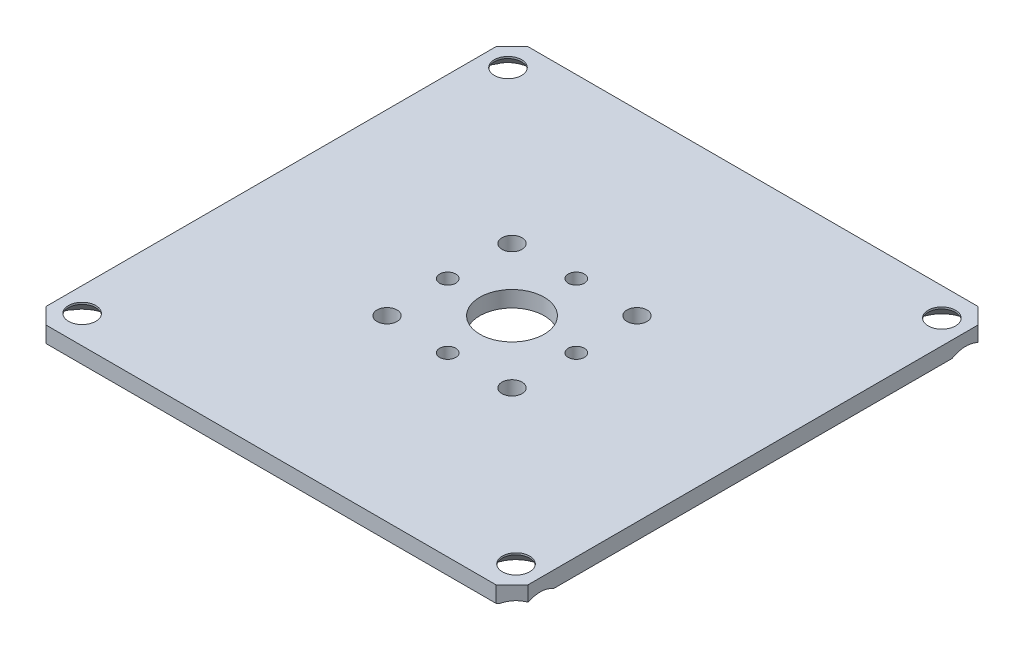
from build123d import *

# Parameters (mm, degrees)
SKETCH1_W                                    = 60
SKETCH1_H                                    = 2
BASE_FLANGE1_DEPTH                           = 60
SKETCH2_R                                    = 1.25
CUT_EXTRUDE1_DEPTH                           = 10
CSK_FOR_M3_HEX_SOCKET_COUNTERSUNK_HE_2_COUNT = 2
CSK_FOR_M3_HEX_SOCKET_COUNTERSUNK_HE_2_PITCH = 54
CSK_FOR_M3_HEX_SOCKET_COUNTERSUNK_HE_3_COUNT = 2
CSK_FOR_M3_HEX_SOCKET_COUNTERSUNK_HE_3_PITCH = 53
CSK_FOR_M3_HEX_SOCKET_COUNTERSUNK_HE_4_COUNT = 2
CSK_FOR_M3_HEX_SOCKET_COUNTERSUNK_HE_4_PITCH = 75.663729752
CUT_EXTRUDE2_REACH                           = 69.112
SKETCH4_R                                    = 4
CHAMFER1_SIZE                                = 2
CUT_EXTRUDE3_REACH                           = 69.112
SKETCH5_R                                    = 1.25
SKETCH5_R_2                                  = 1


# Sheet-metal steps are written as plain solids
with BuildPart() as part:
    # Sketch1 → Base-Flange1 (new body)
    with BuildSketch(Plane.XY):
        with Locations((0, -1)):
            Rectangle(SKETCH1_W, SKETCH1_H)
    extrude(amount=BASE_FLANGE1_DEPTH)

    # Sketch2 → Cut-Extrude1 (cut)
    with BuildSketch(Plane(origin=(0, 0, 0), x_dir=(1, 0, 0), z_dir=(0, 1, 0))):
        with Locations(Location((-27, -3.5, 0), (0, 0, 270))):
            Circle(SKETCH2_R)
        with Locations(Location((-27, -56.5, 0), (0, 0, 270))):
            Circle(SKETCH2_R)
        with Locations(Location((27, -56.5, 0), (0, 0, 270))):
            Circle(SKETCH2_R)
        with Locations(Location((27, -3.5, 0), (0, 0, 270))):
            Circle(SKETCH2_R)
    extrude(amount=-CUT_EXTRUDE1_DEPTH, mode=Mode.SUBTRACT)

    # Sketch3 → CSK for M3 Hex Socket Countersunk Head Screw1 (revolve, cut)
    with BuildSketch(Plane(origin=(27, -2, 3.5), x_dir=(0, 0, -1), z_dir=(1, 0, 0))):
        Polygon((0, 0), (0, 2), (1.7, 2), (1.7, 1.77), (3.47, 0), align=None)
    csk_for_m3_hex_socket_countersunk_head_s = revolve(axis=Axis((27, -8.35, 3.5), (0, 1, 0)), mode=Mode.SUBTRACT)

    # CSK for M3 Hex Socket Countersunk He 2: CSK for M3 Hex Socket Countersunk Head Screw1 ×2
    with Locations(*[(-i * CSK_FOR_M3_HEX_SOCKET_COUNTERSUNK_HE_2_PITCH, 0, 0) for i in range(1, CSK_FOR_M3_HEX_SOCKET_COUNTERSUNK_HE_2_COUNT)]):
        add(csk_for_m3_hex_socket_countersunk_head_s, mode=Mode.SUBTRACT)

    # CSK for M3 Hex Socket Countersunk He 3: CSK for M3 Hex Socket Countersunk Head Screw1 ×2
    with Locations(*[(0, 0, i * CSK_FOR_M3_HEX_SOCKET_COUNTERSUNK_HE_3_PITCH) for i in range(1, CSK_FOR_M3_HEX_SOCKET_COUNTERSUNK_HE_3_COUNT)]):
        add(csk_for_m3_hex_socket_countersunk_head_s, mode=Mode.SUBTRACT)

    # CSK for M3 Hex Socket Countersunk He 4: CSK for M3 Hex Socket Countersunk Head Screw1 ×2
    with Locations(*[Vector(-0.7136840884914971, 0, 0.7004677164823951) * (i * CSK_FOR_M3_HEX_SOCKET_COUNTERSUNK_HE_4_PITCH) for i in range(1, CSK_FOR_M3_HEX_SOCKET_COUNTERSUNK_HE_4_COUNT)]):
        add(csk_for_m3_hex_socket_countersunk_head_s, mode=Mode.SUBTRACT)

    # Sketch4 → Cut-Extrude2 (cut, up to next)
    with BuildSketch(Plane(origin=(0, 0, 0), x_dir=(1, 0, 0), z_dir=(0, 1, 0)), mode=Mode.PRIVATE) as cut_extrude2_sk1:
        with Locations(Location((0, -30, 0), (0, 0, 270))):
            Circle(SKETCH4_R)
    cut_extrude2_tool1 = extrude(cut_extrude2_sk1.sketch, amount=-CUT_EXTRUDE2_REACH, mode=Mode.PRIVATE) & part.part
    add(cut_extrude2_tool1.solids().sort_by_distance((0, 0, 30))[0], mode=Mode.SUBTRACT)

    # Chamfer1
    # the kernel refuses this chamfer: 2 mm, written as the material it takes off along each edge
    with BuildSketch(Plane(origin=(30, 5.143365976, 0), x_dir=(-0.9996219169112968, 0, -0.02749587661058639), z_dir=(0, -1, 0)), Plane(origin=(-30, -7.143365976, 60), x_dir=(-0.027495876610585647, 0, -0.9996219169112968), z_dir=(0, 1, 0))) as chamfer1_piece_1:
        Polygon((CHAMFER1_SIZE * 0.999621916911, -CHAMFER1_SIZE * 0.0274958766106), (-CHAMFER1_SIZE * 0.0274958766106, -CHAMFER1_SIZE * 0.999621916911), (0, 0), align=None)
    extrude(amount=12.286731952, mode=Mode.SUBTRACT)
    with BuildSketch(Plane(origin=(30, 5.143365976, 60), x_dir=(-0.9996219169112968, 0, 0.027495876610585647), z_dir=(0, -1, 0)), Plane(origin=(-30, -7.143365976, 0), x_dir=(-0.02749587661058563, 0, 0.9996219169112968), z_dir=(0, 1, 0))) as chamfer1_piece_2:
        Polygon((CHAMFER1_SIZE * 0.999621916911, CHAMFER1_SIZE * 0.0274958766106), (-CHAMFER1_SIZE * 0.0274958766106, CHAMFER1_SIZE * 0.999621916911), (0, 0), align=None)
    extrude(amount=12.286731952, mode=Mode.SUBTRACT)

    # Sketch5 → Cut-Extrude3 (cut, up to next)
    with BuildSketch(Plane.XZ.offset(2), mode=Mode.PRIVATE) as cut_extrude3_sk1:
        with Locations(Location((7.778174593, 37.778174593, 0), (0, 0, 270))):
            Circle(SKETCH5_R)
    cut_extrude3_tool1 = extrude(cut_extrude3_sk1.sketch, amount=-CUT_EXTRUDE3_REACH, mode=Mode.PRIVATE) & part.part
    # Sketch5 → Cut-Extrude3 (cut, up to next)
    with BuildSketch(Plane.XZ.offset(2), mode=Mode.PRIVATE) as cut_extrude3_sk2:
        with Locations(Location((-7.778174593, 37.778174593, 0), (0, 0, 270))):
            Circle(SKETCH5_R)
    cut_extrude3_tool2 = extrude(cut_extrude3_sk2.sketch, amount=-CUT_EXTRUDE3_REACH, mode=Mode.PRIVATE) & part.part
    # Sketch5 → Cut-Extrude3 (cut, up to next)
    with BuildSketch(Plane.XZ.offset(2), mode=Mode.PRIVATE) as cut_extrude3_sk3:
        with Locations(Location((-7.778174593, 22.221825407, 0), (0, 0, 270))):
            Circle(SKETCH5_R)
    cut_extrude3_tool3 = extrude(cut_extrude3_sk3.sketch, amount=-CUT_EXTRUDE3_REACH, mode=Mode.PRIVATE) & part.part
    # Sketch5 → Cut-Extrude3 (cut, up to next)
    with BuildSketch(Plane.XZ.offset(2), mode=Mode.PRIVATE) as cut_extrude3_sk4:
        with Locations(Location((7.778174593, 22.221825407, 0), (0, 0, 270))):
            Circle(SKETCH5_R)
    cut_extrude3_tool4 = extrude(cut_extrude3_sk4.sketch, amount=-CUT_EXTRUDE3_REACH, mode=Mode.PRIVATE) & part.part
    # Sketch5 → Cut-Extrude3 (cut, up to next)
    with BuildSketch(Plane.XZ.offset(2), mode=Mode.PRIVATE) as cut_extrude3_sk5:
        with Locations(Location((8, 30, 0), (0, 0, 270))):
            Circle(SKETCH5_R_2)
    cut_extrude3_tool5 = extrude(cut_extrude3_sk5.sketch, amount=-CUT_EXTRUDE3_REACH, mode=Mode.PRIVATE) & part.part
    # Sketch5 → Cut-Extrude3 (cut, up to next)
    with BuildSketch(Plane.XZ.offset(2), mode=Mode.PRIVATE) as cut_extrude3_sk6:
        with Locations(Location((0, 22, 0), (0, 0, 270))):
            Circle(SKETCH5_R_2)
    cut_extrude3_tool6 = extrude(cut_extrude3_sk6.sketch, amount=-CUT_EXTRUDE3_REACH, mode=Mode.PRIVATE) & part.part
    # Sketch5 → Cut-Extrude3 (cut, up to next)
    with BuildSketch(Plane.XZ.offset(2), mode=Mode.PRIVATE) as cut_extrude3_sk7:
        with Locations(Location((-8, 30, 0), (0, 0, 270))):
            Circle(SKETCH5_R_2)
    cut_extrude3_tool7 = extrude(cut_extrude3_sk7.sketch, amount=-CUT_EXTRUDE3_REACH, mode=Mode.PRIVATE) & part.part
    # Sketch5 → Cut-Extrude3 (cut, up to next)
    with BuildSketch(Plane.XZ.offset(2), mode=Mode.PRIVATE) as cut_extrude3_sk8:
        with Locations(Location((0, 38, 0), (0, 0, 270))):
            Circle(SKETCH5_R_2)
    cut_extrude3_tool8 = extrude(cut_extrude3_sk8.sketch, amount=-CUT_EXTRUDE3_REACH, mode=Mode.PRIVATE) & part.part
    add(cut_extrude3_tool1.solids().sort_by_distance((7.778175, -2, 37.778175))[0], mode=Mode.SUBTRACT)
    add(cut_extrude3_tool2.solids().sort_by_distance((-7.778175, -2, 37.778175))[0], mode=Mode.SUBTRACT)
    add(cut_extrude3_tool3.solids().sort_by_distance((-7.778175, -2, 22.221825))[0], mode=Mode.SUBTRACT)
    add(cut_extrude3_tool4.solids().sort_by_distance((7.778175, -2, 22.221825))[0], mode=Mode.SUBTRACT)
    add(cut_extrude3_tool5.solids().sort_by_distance((8, -2, 30))[0], mode=Mode.SUBTRACT)
    add(cut_extrude3_tool6.solids().sort_by_distance((0, -2, 22))[0], mode=Mode.SUBTRACT)
    add(cut_extrude3_tool7.solids().sort_by_distance((-8, -2, 30))[0], mode=Mode.SUBTRACT)
    add(cut_extrude3_tool8.solids().sort_by_distance((0, -2, 38))[0], mode=Mode.SUBTRACT)


solid = part.part
